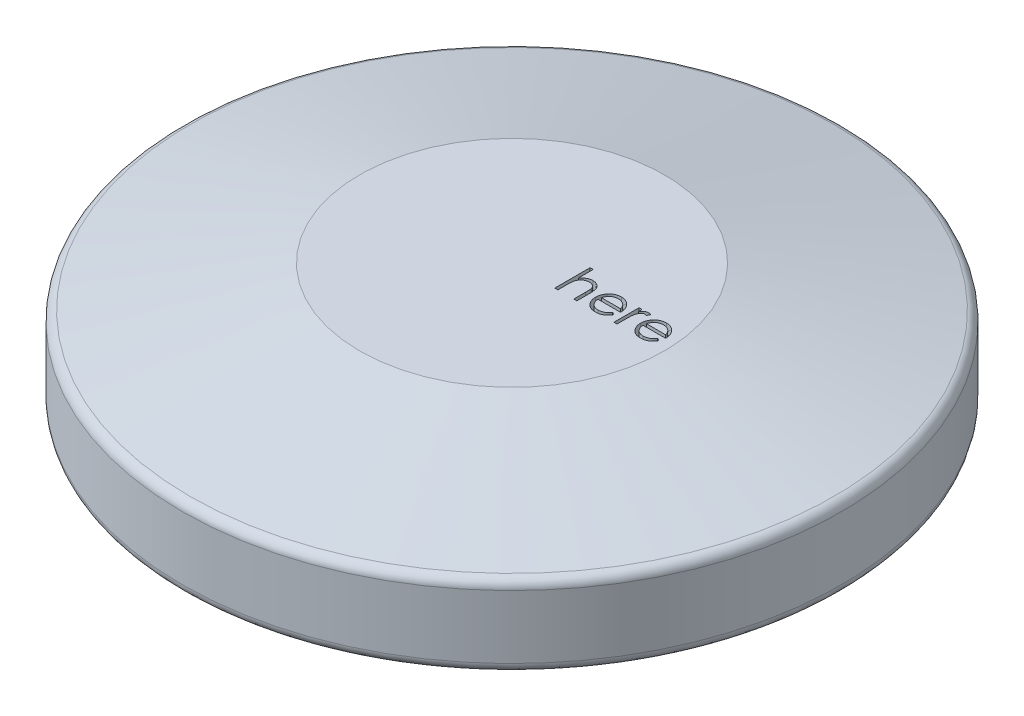
from build123d import *

# Parameters (mm, degrees)
BOSS_EXTRUDE1_DEPTH      = 4
BOSS_EXTRUDE1_DEPTH_BACK = 4
SKETCH1_R                = 33.5
SKETCH1_R_2              = 15.5
BOSS_EXTRUDE2_DEPTH      = 8.375
BOSS_EXTRUDE2_DEPTH_BACK = 8.375
SKETCH1_2_R              = 15.5
FILLET1_R                = 1
FILLET2_R                = 1
CUT_EXTRUDE1_DEPTH       = 1


with BuildPart() as part:
    # Sketch1 → Boss-Extrude1 (new, two sides: drawn at the far end of the back side and taken through both)
    with BuildSketch(Plane(origin=(0, 0, 0), x_dir=(1, 0, 0), z_dir=(0, 1, 0)).offset(-BOSS_EXTRUDE1_DEPTH_BACK)):
        with Locations(Location((0, 0, 0), (0, 0, 270))):
            Circle(SKETCH1_R)
        with Locations(Location((0, 0, 0), (0, 0, 270))):
            Circle(SKETCH1_R_2, mode=Mode.SUBTRACT)
    extrude(amount=BOSS_EXTRUDE1_DEPTH + BOSS_EXTRUDE1_DEPTH_BACK)

    # Sketch1<2> → Boss-Extrude2 (add, two sides: drawn at the far end of the back side and taken through both)
    with BuildSketch(Plane(origin=(0, 0, 0), x_dir=(1, 0, 0), z_dir=(0, 1, 0)).offset(-BOSS_EXTRUDE2_DEPTH_BACK)):
        with Locations(Location((0, 0, 0), (0, 0, 270))):
            Circle(SKETCH1_2_R)
    extrude(amount=BOSS_EXTRUDE2_DEPTH + BOSS_EXTRUDE2_DEPTH_BACK)

    # loft up to a face of the part (loft1)
    loft([Face(Wire([part.edges().sort_by_distance((24.420449019, 4, -22.932328049))[0]])), Face(Wire([part.edges().sort_by_distance((11.299013725, 8.375, -10.610480142))[0]]))])

    # Loft2: read off the stored shape, not the designer's step
    # Loft2: loft between two sections, ruled curve by curve
    loft2_from = [
        Edge.make_bspline([(15.141434837, -8.375, 3.314657008), (21.770748852, -8.375, -26.968212666), (-8.512120821, -8.375, -33.597526682), (-15.141434837, -8.375, -3.314657008), (-21.770748852, -8.375, 26.968212666), (8.512120821, -8.375, 33.597526682), (15.141434837, -8.375, 3.314657008)], [0, 0, 0, 0, 0.5, 0.5, 0.5, 1, 1, 1, 1], 3, [1, 0.333333333, 0.333333333, 1, 0.333333333, 0.333333333, 1]),
    ]
    loft2_to = [
        Edge.make_bspline([(33.499576792, -4, -0.168388657), (33.162799478, -4, -67.167542242), (-33.836354107, -4, -66.830764927), (-33.499576792, -4, 0.168388657), (-33.162799478, -4, 67.167542242), (33.836354107, -4, 66.830764927), (33.499576792, -4, -0.168388657)], [0, 0, 0, 0, 0.5, 0.5, 0.5, 1, 1, 1, 1], 3, [1, 0.333333333, 0.333333333, 1, 0.333333333, 0.333333333, 1]),
    ]
    loft2 = Solid(Shell([*[Face.make_surface_from_curves(loft2_from[k], loft2_to[k]) for k in range(1)], Face(Wire(loft2_from)), Face(Wire(loft2_to))]))
    add(loft2)

    # Fillet1
    fillet1_edges = [part.edges().sort_by_distance(p)[0] for p in [
        (0, 4, -33.5),
    ]]
    fillet(fillet1_edges, radius=FILLET1_R)

    # Fillet2
    fillet2_edges = [part.edges().sort_by_distance(p)[0] for p in [
        (-23.747536925, -4, -23.628467788),
    ]]
    fillet(fillet2_edges, radius=FILLET2_R)

    # Sketch2 → Cut-Extrude1 (cut)
    # profile 1 of 4: a face of its own
    with BuildSketch(Plane(origin=(0, 8.375, 0), x_dir=(1, 0, 0), z_dir=(0, 1, 0))):
        with BuildLine():
            Line((4.393519833, 3.542807265), (4.707622397, 3.542807265))
            Line((4.707622397, 3.542807265), (4.707622397, 2.027683066))
            add(Edge.make_bspline(
                [(4.707622397, 2.027683066), (4.741339699, 2.069827049), (4.806989013, 2.151883541), (4.917485129, 2.258944732), (5.030956001, 2.351743353), (5.151320811, 2.425613811), (5.276371332, 2.483970354), (5.406634976, 2.525358), (5.542135947, 2.550809097), (5.634161097, 2.554007515), (5.680779448, 2.555627778)],
                knots=[0, 0, 0, 0, 1.125788106, 2.19196713, 3.20547328, 4.180437432, 5.132270164, 6.079753143, 7.027236121, 8, 8, 8, 8], degree=3))
            add(Edge.make_bspline(
                [(5.680779448, 2.555627778), (5.728109841, 2.553882348), (5.820746837, 2.55046612), (5.955628299, 2.523452739), (6.081589174, 2.477295301), (6.198255017, 2.414128275), (6.303079714, 2.335455448), (6.395929478, 2.244623926), (6.471770277, 2.139350007), (6.523369394, 2.042093754), (6.556942802, 1.955555), (6.578194628, 1.881318487), (6.596213827, 1.798596574), (6.611913562, 1.707431842), (6.622377144, 1.60738667), (6.630781762, 1.498912416), (6.636758216, 1.382015298), (6.636989821, 1.301095048), (6.637109577, 1.259253579)],
                knots=[0, 0, 0, 0, 1.235656852, 2.418478516, 3.575258207, 4.727955599, 5.870717718, 6.98870536, 8.107142894, 9.245821548, 9.854588956, 10.528768408, 11.260415777, 12.065282286, 12.943670737, 13.886611085, 14.907229059, 16, 16, 16, 16], degree=3))
            Line((6.637109577, 1.259253579), (6.637109577, -0.046936325))
            Line((6.637109577, -0.046936325), (6.323007012, -0.046936325))
            Line((6.323007012, -0.046936325), (6.323007012, 1.156188675))
            add(Edge.make_bspline(
                [(6.323007012, 1.156188675), (6.322816709, 1.191011345), (6.322452692, 1.257621185), (6.321249347, 1.352987294), (6.318563132, 1.439483428), (6.314222306, 1.51683238), (6.309656999, 1.585141983), (6.303373681, 1.644313038), (6.296063447, 1.694426813), (6.289494666, 1.724591442), (6.286548679, 1.738119765)],
                knots=[0, 0, 0, 0, 1.430932559, 2.737130458, 3.918967929, 4.986496826, 5.920444988, 6.731744033, 7.431208747, 8, 8, 8, 8], degree=3))
            add(Edge.make_bspline(
                [(6.286548679, 1.738119765), (6.275124434, 1.777814029), (6.253161389, 1.85412602), (6.202113412, 1.95778843), (6.138354401, 2.04617317), (6.06050714, 2.118087458), (5.969948775, 2.174498998), (5.866088811, 2.21356678), (5.749904743, 2.237814502), (5.668053271, 2.240253805), (5.625390827, 2.241525214)],
                knots=[0, 0, 0, 0, 1.090059168, 2.095632401, 3.037101401, 3.955032261, 4.878929692, 5.839099886, 6.873700383, 8, 8, 8, 8], degree=3))
            add(Edge.make_bspline(
                [(5.625390827, 2.241525214), (5.600123053, 2.241049388), (5.550118783, 2.24010774), (5.475970117, 2.230653841), (5.404041054, 2.215205122), (5.333638876, 2.194300584), (5.266255678, 2.165855047), (5.199927353, 2.132924858), (5.136533144, 2.092616603), (5.074947327, 2.047390836), (5.017629794, 1.997321076), (4.964302679, 1.944474121), (4.916764338, 1.888199157), (4.873695747, 1.82939904), (4.836517462, 1.767267247), (4.80406438, 1.702402929), (4.776528683, 1.634720783), (4.762845991, 1.587745721), (4.755999801, 1.56424156)],
                knots=[0, 0, 0, 0, 1.024319606, 2.027102035, 3.025350316, 4.005802111, 5.00026367, 5.987881639, 7.005602596, 8.042517216, 9.083927026, 10.089214625, 11.084353441, 12.06828073, 13.041928858, 14.016821737, 15.00770877, 16, 16, 16, 16], degree=3))
            add(Edge.make_bspline(
                [(4.755999801, 1.56424156), (4.752060374, 1.547220609), (4.743475877, 1.510129862), (4.734161044, 1.448955538), (4.725823247, 1.377869166), (4.718774697, 1.296978566), (4.714451611, 1.205987324), (4.70979337, 1.105516364), (4.708059356, 0.994936344), (4.707772403, 0.918040836), (4.707622397, 0.877843323)],
                knots=[0, 0, 0, 0, 0.607992626, 1.324890765, 2.152360218, 3.099583803, 4.150613268, 5.323148443, 6.60066238, 8, 8, 8, 8], degree=3))
            Line((4.707622397, 0.877843323), (4.707622397, -0.046936325))
            Line((4.707622397, -0.046936325), (4.393519833, -0.046936325))
            Line((4.393519833, -0.046936325), (4.393519833, 3.542807265))
        make_face()
    # profile 2 of 4: a face of its own
    with BuildSketch(Plane(origin=(0, 8.375, 0), x_dir=(1, 0, 0), z_dir=(0, 1, 0))):
        with BuildLine():
            Line((9.454216948, 0.760755983), (9.733263423, 0.614221528))
            add(Edge.make_bspline(
                [(9.733263423, 0.614221528), (9.711026827, 0.574778197), (9.667763219, 0.498037094), (9.593362471, 0.392605233), (9.515370399, 0.297757518), (9.430266431, 0.216027863), (9.340596752, 0.144776478), (9.245864097, 0.082438654), (9.145575279, 0.029320133), (9.039725554, -0.015432395), (8.927426003, -0.049841889), (8.808404487, -0.07414611), (8.682432991, -0.089169378), (8.596086811, -0.090914519), (8.551873198, -0.091808119)],
                knots=[0, 0, 0, 0, 1.120438281, 2.179929193, 3.190490725, 4.156257408, 5.095198341, 6.022838206, 6.959905092, 7.901321166, 8.864066838, 9.862729781, 10.905609505, 12, 12, 12, 12], degree=3))
            add(Edge.make_bspline(
                [(8.551873198, -0.091808119), (8.502731221, -0.090660944), (8.406869459, -0.088423137), (8.267329712, -0.069130673), (8.135950294, -0.037658314), (8.01273859, 0.006307227), (7.897996338, 0.063734551), (7.791495483, 0.133694033), (7.692675957, 0.215826288), (7.604651748, 0.310842731), (7.525407865, 0.412524689), (7.455482045, 0.518480573), (7.397024614, 0.628443798), (7.349472004, 0.741714322), (7.311067139, 0.857578215), (7.284300435, 0.977089683), (7.268870687, 1.099925267), (7.266506242, 1.183022603), (7.265314705, 1.224898611)],
                knots=[0, 0, 0, 0, 1.145258523, 2.234067595, 3.276747158, 4.290159414, 5.277019952, 6.260822364, 7.254936242, 8.264827045, 9.274100331, 10.257902744, 11.220704747, 12.172965371, 13.118907548, 14.062713208, 15.023725156, 16, 16, 16, 16], degree=3))
            add(Edge.make_bspline(
                [(7.265314705, 1.224898611), (7.266373846, 1.264193442), (7.268472924, 1.342070606), (7.281703712, 1.457336151), (7.305152005, 1.569364603), (7.337328329, 1.678249051), (7.378879575, 1.783807185), (7.429711794, 1.886103249), (7.489904172, 1.985028389), (7.536376846, 2.047431523), (7.559785859, 2.078864957)],
                knots=[0, 0, 0, 0, 1.024358464, 2.0301432, 3.019427413, 4.004406732, 4.986367066, 5.972626655, 6.978780325, 8, 8, 8, 8], degree=3))
            add(Edge.make_bspline(
                [(7.559785859, 2.078864957), (7.591493541, 2.116733828), (7.653904488, 2.191271978), (7.759460843, 2.289210304), (7.87376104, 2.371254079), (7.995372666, 2.439261215), (8.12570914, 2.490934862), (8.263018431, 2.529442444), (8.408864017, 2.551020455), (8.508569238, 2.554068289), (8.559585538, 2.555627778)],
                knots=[0, 0, 0, 0, 1.030682036, 2.02871468, 2.997146059, 3.962720338, 4.930598197, 5.918074684, 6.934738563, 8, 8, 8, 8], degree=3))
            add(Edge.make_bspline(
                [(8.559585538, 2.555627778), (8.612033143, 2.554273729), (8.714923389, 2.551617394), (8.86495551, 2.52699106), (9.006916227, 2.487938506), (9.140748731, 2.432784715), (9.266466592, 2.361625164), (9.383252642, 2.273483322), (9.493104154, 2.171065235), (9.557012733, 2.092302025), (9.589533455, 2.052222329)],
                knots=[0, 0, 0, 0, 1.056321875, 2.072262726, 3.055038591, 4.01806755, 4.982017516, 5.957941055, 6.960871419, 8, 8, 8, 8], degree=3))
            add(Edge.make_bspline(
                [(9.589533455, 2.052222329), (9.611660393, 2.022018748), (9.655766986, 1.961812629), (9.711014086, 1.863641472), (9.758971481, 1.760930878), (9.797304442, 1.652020581), (9.828343943, 1.538201), (9.850800762, 1.418658456), (9.863970381, 1.293428544), (9.866559078, 1.208101989), (9.867878807, 1.164602137)],
                knots=[0, 0, 0, 0, 0.94817472, 1.890038105, 2.849395472, 3.817997239, 4.812318967, 5.836947057, 6.897266129, 8, 8, 8, 8], degree=3))
            Line((9.867878807, 1.164602137), (7.579417269, 1.164602137))
            add(Edge.make_bspline(
                [(7.579417269, 1.164602137), (7.580956875, 1.130901673), (7.583984449, 1.064631069), (7.598099592, 0.967660286), (7.620348366, 0.875286944), (7.651617429, 0.788203902), (7.689484274, 0.705273774), (7.735869991, 0.627111737), (7.791209545, 0.554073807), (7.852935244, 0.48550667), (7.92164234, 0.424445908), (7.993925087, 0.369794132), (8.070818652, 0.323988535), (8.151716735, 0.286808646), (8.23648852, 0.25770233), (8.325160716, 0.237834509), (8.417558832, 0.224527402), (8.480544566, 0.223047737), (8.512610378, 0.222294445)],
                knots=[0, 0, 0, 0, 1.094153842, 2.151609401, 3.174256925, 4.172055639, 5.149267565, 6.128595816, 7.11444997, 8.118368179, 9.117203808, 10.09244225, 11.054858984, 12.015122123, 12.976791628, 13.957293641, 14.960065497, 16, 16, 16, 16], degree=3))
            add(Edge.make_bspline(
                [(8.512610378, 0.222294445), (8.543961525, 0.222902501), (8.606168216, 0.224109002), (8.698809074, 0.235840913), (8.789948601, 0.254811189), (8.879209584, 0.280701179), (8.96478043, 0.312278031), (9.04402598, 0.350380889), (9.116906196, 0.392530635), (9.185023163, 0.440740311), (9.251094156, 0.499748498), (9.316636642, 0.573384219), (9.386913296, 0.660471746), (9.430902888, 0.726017412), (9.454216948, 0.760755983)],
                knots=[0, 0, 0, 0, 0.99110716, 1.966546729, 2.947904876, 3.932708344, 4.903319531, 5.828989031, 6.710028674, 7.56322171, 8.463672341, 9.504779593, 10.677557249, 12, 12, 12, 12], degree=3))
        make_face()
        with BuildLine():
            add(Edge.make_bspline(
                [(9.553776243, 1.478704701), (9.542279619, 1.520367575), (9.520152317, 1.600555195), (9.473915953, 1.711596086), (9.421844412, 1.810283987), (9.360222681, 1.89586362), (9.290403955, 1.971867133), (9.209758772, 2.038285718), (9.119322879, 2.097703169), (9.019563738, 2.147855669), (8.913921953, 2.190545527), (8.803315761, 2.219170643), (8.690457973, 2.238780185), (8.614123687, 2.240606294), (8.575711339, 2.241525214)],
                knots=[0, 0, 0, 0, 1.154881502, 2.222775134, 3.210006277, 4.132804581, 5.035138423, 5.962687519, 6.919655026, 7.923214229, 8.944639381, 9.960483929, 10.97369054, 12, 12, 12, 12], degree=3))
            add(Edge.make_bspline(
                [(8.575711339, 2.241525214), (8.544361901, 2.240913542), (8.482390652, 2.239704396), (8.391089584, 2.228234267), (8.303409885, 2.209274422), (8.218704597, 2.183309465), (8.138083729, 2.148700863), (8.05988896, 2.108117636), (7.986108564, 2.058576053), (7.939967269, 2.020817198), (7.916656852, 2.00174156)],
                knots=[0, 0, 0, 0, 1.04873581, 2.073130211, 3.073294108, 4.04793562, 5.032784715, 6.005352987, 6.992311501, 8, 8, 8, 8], degree=3))
            add(Edge.make_bspline(
                [(7.916656852, 2.00174156), (7.89996357, 1.986647244), (7.866180436, 1.956100028), (7.821039915, 1.903470822), (7.777819442, 1.84671926), (7.738485789, 1.783674135), (7.702408203, 1.715053356), (7.668648225, 1.641435721), (7.638261813, 1.562262591), (7.621165703, 1.507090151), (7.612369993, 1.478704701)],
                knots=[0, 0, 0, 0, 0.879870761, 1.780643979, 2.707998968, 3.669668524, 4.684282772, 5.740141944, 6.837334558, 8, 8, 8, 8], degree=3))
            Line((7.612369993, 1.478704701), (9.553776243, 1.478704701))
        make_face(mode=Mode.SUBTRACT)
    # profile 3 of 4: a face of its own
    with BuildSketch(Plane(origin=(0, 8.375, 0), x_dir=(1, 0, 0), z_dir=(0, 1, 0))):
        with BuildLine():
            Line((10.406340346, 2.510755983), (10.72044291, 2.510755983))
            Line((10.72044291, 2.510755983), (10.72044291, 2.134253579))
            add(Edge.make_bspline(
                [(10.72044291, 2.134253579), (10.743631669, 2.169309408), (10.78797999, 2.236353407), (10.861692919, 2.325022708), (10.93719625, 2.398437754), (11.014851438, 2.456941273), (11.095229537, 2.500754392), (11.176566489, 2.532847427), (11.260141959, 2.551824742), (11.316303883, 2.554358401), (11.344441307, 2.555627778)],
                knots=[0, 0, 0, 0, 1.2804753, 2.448899062, 3.506932113, 4.484331642, 5.4025378, 6.288909075, 7.142734305, 8, 8, 8, 8], degree=3))
            add(Edge.make_bspline(
                [(11.344441307, 2.555627778), (11.366267634, 2.554437251), (11.411176719, 2.551987666), (11.479159309, 2.534776841), (11.549202761, 2.507298818), (11.594345148, 2.481458596), (11.617878807, 2.467987554)],
                knots=[0, 0, 0, 0, 0.901110191, 1.854092781, 2.881294221, 4, 4, 4, 4], degree=3))
            Line((11.617878807, 2.467987554), (11.445402846, 2.195952297))
            add(Edge.make_bspline(
                [(11.445402846, 2.195952297), (11.430293825, 2.202692563), (11.40161401, 2.215486879), (11.359659444, 2.230628889), (11.320978107, 2.239544805), (11.296334549, 2.240895522), (11.284845955, 2.241525214)],
                knots=[0, 0, 0, 0, 1.180555205, 2.24091978, 3.179933427, 4, 4, 4, 4], degree=3))
            add(Edge.make_bspline(
                [(11.284845955, 2.241525214), (11.259640221, 2.239845177), (11.208227831, 2.236418387), (11.132743332, 2.20947958), (11.059496126, 2.165954339), (11.001324464, 2.117683228), (10.956282211, 2.07113543), (10.924141986, 2.030487028), (10.894659239, 1.984908396), (10.866489018, 1.935178712), (10.840822724, 1.880448866), (10.816868055, 1.821265653), (10.795209192, 1.757560524), (10.782858948, 1.713178004), (10.776532653, 1.690443483)],
                knots=[0, 0, 0, 0, 1.125678352, 2.296057538, 3.5422874, 4.923748041, 5.663163013, 6.437101912, 7.23742474, 8.08941207, 8.991984279, 9.93940061, 10.944477711, 12, 12, 12, 12], degree=3))
            add(Edge.make_bspline(
                [(10.776532653, 1.690443483), (10.77180026, 1.67016631), (10.761318368, 1.625253911), (10.751126831, 1.549905386), (10.741057313, 1.460881727), (10.733960694, 1.357935135), (10.727382652, 1.241322691), (10.72367257, 1.110866745), (10.720569429, 0.966433394), (10.720486362, 0.865459041), (10.72044291, 0.812638996)],
                knots=[0, 0, 0, 0, 0.566838948, 1.255505196, 2.06880316, 3.007127437, 4.065329342, 5.249902469, 6.561414163, 8, 8, 8, 8], degree=3))
            Line((10.72044291, 0.812638996), (10.72044291, -0.046936325))
            Line((10.72044291, -0.046936325), (10.406340346, -0.046936325))
            Line((10.406340346, -0.046936325), (10.406340346, 2.510755983))
        make_face()
    # profile 4 of 4: a face of its own
    with BuildSketch(Plane(origin=(0, 8.375, 0), x_dir=(1, 0, 0), z_dir=(0, 1, 0))):
        with BuildLine():
            Line((14.031140025, 0.760755983), (14.3101865, 0.614221528))
            add(Edge.make_bspline(
                [(14.3101865, 0.614221528), (14.287949904, 0.574778197), (14.244686296, 0.498037094), (14.170285548, 0.392605233), (14.092293475, 0.297757518), (14.007189507, 0.216027863), (13.917519828, 0.144776478), (13.822787174, 0.082438654), (13.722498356, 0.029320133), (13.616648631, -0.015432395), (13.50434908, -0.049841889), (13.385327564, -0.07414611), (13.259356068, -0.089169378), (13.173009888, -0.090914519), (13.128796275, -0.091808119)],
                knots=[0, 0, 0, 0, 1.120438281, 2.179929193, 3.190490725, 4.156257408, 5.095198341, 6.022838206, 6.959905092, 7.901321166, 8.864066838, 9.862729781, 10.905609505, 12, 12, 12, 12], degree=3))
            add(Edge.make_bspline(
                [(13.128796275, -0.091808119), (13.079654298, -0.090660944), (12.983792536, -0.088423137), (12.844252789, -0.069130673), (12.712873371, -0.037658314), (12.589661667, 0.006307227), (12.474919415, 0.063734551), (12.36841856, 0.133694033), (12.269599034, 0.215826288), (12.181574825, 0.310842731), (12.102330942, 0.412524689), (12.032405122, 0.518480573), (11.973947691, 0.628443798), (11.926395081, 0.741714322), (11.887990216, 0.857578215), (11.861223512, 0.977089683), (11.845793764, 1.099925267), (11.843429319, 1.183022603), (11.842237782, 1.224898611)],
                knots=[0, 0, 0, 0, 1.145258523, 2.234067595, 3.276747158, 4.290159414, 5.277019952, 6.260822364, 7.254936242, 8.264827045, 9.274100331, 10.257902744, 11.220704747, 12.172965371, 13.118907548, 14.062713208, 15.023725156, 16, 16, 16, 16], degree=3))
            add(Edge.make_bspline(
                [(11.842237782, 1.224898611), (11.843296923, 1.264193442), (11.845396001, 1.342070606), (11.858626789, 1.457336151), (11.882075082, 1.569364603), (11.914251406, 1.678249051), (11.955802652, 1.783807185), (12.006634871, 1.886103249), (12.066827249, 1.985028389), (12.113299923, 2.047431523), (12.136708936, 2.078864957)],
                knots=[0, 0, 0, 0, 1.024358464, 2.0301432, 3.019427413, 4.004406732, 4.986367066, 5.972626655, 6.978780325, 8, 8, 8, 8], degree=3))
            add(Edge.make_bspline(
                [(12.136708936, 2.078864957), (12.168416618, 2.116733828), (12.230827565, 2.191271978), (12.33638392, 2.289210304), (12.450684117, 2.371254079), (12.572295743, 2.439261215), (12.702632217, 2.490934862), (12.839941508, 2.529442444), (12.985787094, 2.551020455), (13.085492315, 2.554068289), (13.136508615, 2.555627778)],
                knots=[0, 0, 0, 0, 1.030682036, 2.02871468, 2.997146059, 3.962720338, 4.930598197, 5.918074684, 6.934738563, 8, 8, 8, 8], degree=3))
            add(Edge.make_bspline(
                [(13.136508615, 2.555627778), (13.18895622, 2.554273729), (13.291846466, 2.551617394), (13.441878587, 2.52699106), (13.583839304, 2.487938506), (13.717671808, 2.432784715), (13.843389669, 2.361625164), (13.960175718, 2.273483322), (14.070027231, 2.171065235), (14.13393581, 2.092302025), (14.166456532, 2.052222329)],
                knots=[0, 0, 0, 0, 1.056321875, 2.072262726, 3.055038591, 4.01806755, 4.982017516, 5.957941055, 6.960871419, 8, 8, 8, 8], degree=3))
            add(Edge.make_bspline(
                [(14.166456532, 2.052222329), (14.18858347, 2.022018748), (14.232690063, 1.961812629), (14.287937163, 1.863641472), (14.335894558, 1.760930878), (14.374227519, 1.652020581), (14.40526702, 1.538201), (14.427723839, 1.418658456), (14.440893458, 1.293428544), (14.443482155, 1.208101989), (14.444801884, 1.164602137)],
                knots=[0, 0, 0, 0, 0.94817472, 1.890038105, 2.849395472, 3.817997239, 4.812318967, 5.836947057, 6.897266129, 8, 8, 8, 8], degree=3))
            Line((14.444801884, 1.164602137), (12.156340346, 1.164602137))
            add(Edge.make_bspline(
                [(12.156340346, 1.164602137), (12.157879952, 1.130901673), (12.160907526, 1.064631069), (12.175022669, 0.967660286), (12.197271443, 0.875286944), (12.228540506, 0.788203902), (12.266407351, 0.705273774), (12.312793068, 0.627111737), (12.368132622, 0.554073807), (12.429858321, 0.48550667), (12.498565416, 0.424445908), (12.570848164, 0.369794132), (12.647741729, 0.323988535), (12.728639812, 0.286808646), (12.813411597, 0.25770233), (12.902083792, 0.237834509), (12.994481909, 0.224527402), (13.057467643, 0.223047737), (13.089533455, 0.222294445)],
                knots=[0, 0, 0, 0, 1.094153842, 2.151609401, 3.174256925, 4.172055639, 5.149267565, 6.128595816, 7.11444997, 8.118368179, 9.117203808, 10.09244225, 11.054858984, 12.015122123, 12.976791628, 13.957293641, 14.960065497, 16, 16, 16, 16], degree=3))
            add(Edge.make_bspline(
                [(13.089533455, 0.222294445), (13.120884602, 0.222902501), (13.183091293, 0.224109002), (13.275732151, 0.235840913), (13.366871678, 0.254811189), (13.456132661, 0.280701179), (13.541703507, 0.312278031), (13.620949057, 0.350380889), (13.693829273, 0.392530635), (13.761946239, 0.440740311), (13.828017233, 0.499748498), (13.893559719, 0.573384219), (13.963836373, 0.660471746), (14.007825965, 0.726017412), (14.031140025, 0.760755983)],
                knots=[0, 0, 0, 0, 0.99110716, 1.966546729, 2.947904876, 3.932708344, 4.903319531, 5.828989031, 6.710028674, 7.56322171, 8.463672341, 9.504779593, 10.677557249, 12, 12, 12, 12], degree=3))
        make_face()
        with BuildLine():
            add(Edge.make_bspline(
                [(14.13069932, 1.478704701), (14.119202696, 1.520367575), (14.097075394, 1.600555195), (14.05083903, 1.711596086), (13.998767489, 1.810283987), (13.937145758, 1.89586362), (13.867327032, 1.971867133), (13.786681849, 2.038285718), (13.696245956, 2.097703169), (13.596486815, 2.147855669), (13.49084503, 2.190545527), (13.380238838, 2.219170643), (13.26738105, 2.238780185), (13.191046764, 2.240606294), (13.152634416, 2.241525214)],
                knots=[0, 0, 0, 0, 1.154881502, 2.222775134, 3.210006277, 4.132804581, 5.035138423, 5.962687519, 6.919655026, 7.923214229, 8.944639381, 9.960483929, 10.97369054, 12, 12, 12, 12], degree=3))
            add(Edge.make_bspline(
                [(13.152634416, 2.241525214), (13.121284978, 2.240913542), (13.059313729, 2.239704396), (12.968012661, 2.228234267), (12.880332962, 2.209274422), (12.795627674, 2.183309465), (12.715006806, 2.148700863), (12.636812037, 2.108117636), (12.563031641, 2.058576053), (12.516890346, 2.020817198), (12.493579929, 2.00174156)],
                knots=[0, 0, 0, 0, 1.04873581, 2.073130211, 3.073294108, 4.04793562, 5.032784715, 6.005352987, 6.992311501, 8, 8, 8, 8], degree=3))
            add(Edge.make_bspline(
                [(12.493579929, 2.00174156), (12.476886647, 1.986647244), (12.443103513, 1.956100028), (12.397962991, 1.903470822), (12.354742519, 1.84671926), (12.315408866, 1.783674135), (12.27933128, 1.715053356), (12.245571302, 1.641435721), (12.21518489, 1.562262591), (12.19808878, 1.507090151), (12.18929307, 1.478704701)],
                knots=[0, 0, 0, 0, 0.879870761, 1.780643979, 2.707998968, 3.669668524, 4.684282772, 5.740141944, 6.837334558, 8, 8, 8, 8], degree=3))
            Line((12.18929307, 1.478704701), (14.13069932, 1.478704701))
        make_face(mode=Mode.SUBTRACT)
    extrude(amount=-CUT_EXTRUDE1_DEPTH, mode=Mode.SUBTRACT)


solid = part.part
